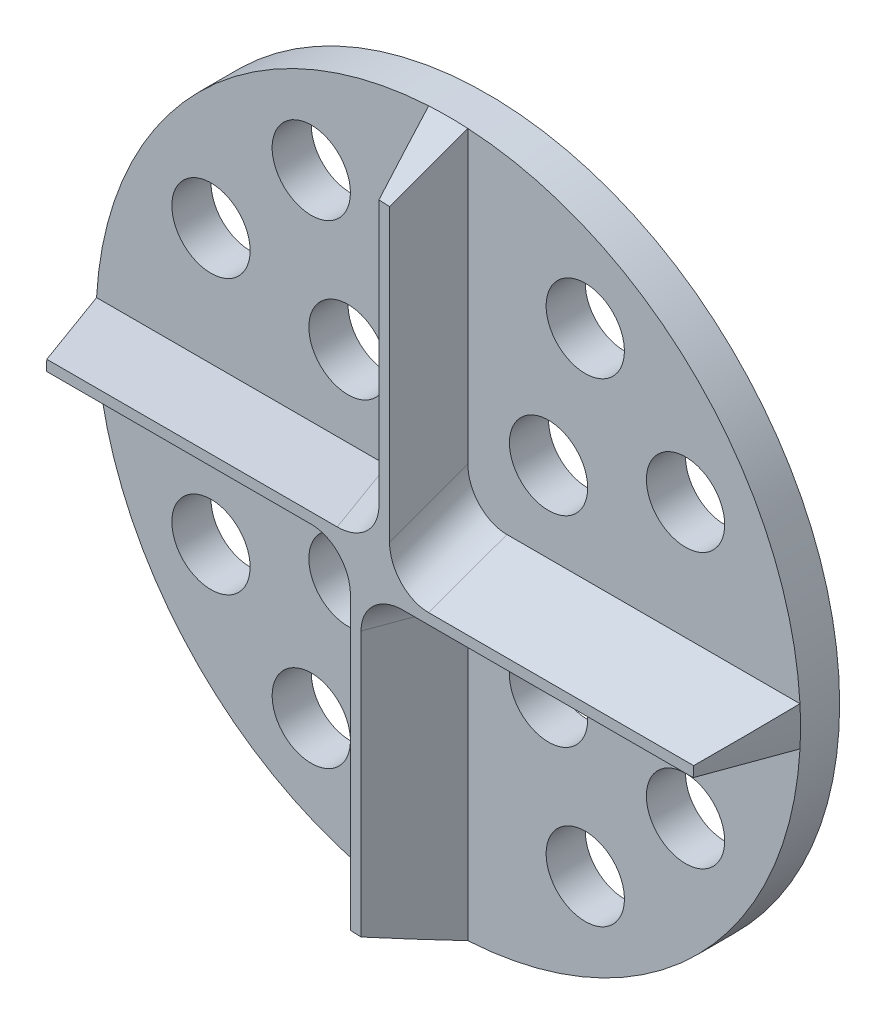
from build123d import *
from build123d.topology import SkipClean

# Parameters (mm, degrees)
BOSS_EXTRUDE1_START = 10
SKETCH1_R           = 45
BOSS_EXTRUDE1_DEPTH = 5
BOSS_EXTRUDE3_DEPTH = 10
CIRPATTERN1_COUNT   = 2
CIRPATTERN1_ANGLE   = 90
SKETCH5_OUTSIDE_W   = 124.038
SKETCH5_OUTSIDE_H   = 124.038
SKETCH5_OUTSIDE_R   = 45
CUT_EXTRUDE1_DEPTH  = 69.82949949
CHAMFER1_START      = -45
CHAMFER1_2_DEPTH    = 42.5
CHAMFER1_START_2    = 2.5
CHAMFER1_3_DEPTH    = 42.5
CHAMFER1_4_DEPTH    = 42.5
CHAMFER1_5_DEPTH    = 42.5
FILLET1_R           = 5
SKETCH6_R           = 5
CUT_EXTRUDE2_DEPTH  = 65.420493634
CIRPATTERN2_COUNT   = 4


with BuildPart() as part:
    # Sketch1 → Boss-Extrude1 (new body)
    with BuildSketch(Plane(origin=(0, 0, 0), x_dir=(0, 1, 0), z_dir=(0, 0, 1)).offset(BOSS_EXTRUDE1_START)):
        with Locations(Location((0, 0, 0), (0, 0, 270))):
            Circle(SKETCH1_R)
    extrude(amount=BOSS_EXTRUDE1_DEPTH)

    # Sketch4 → Boss-Extrude3 (add)
    with BuildSketch(Plane.XY.offset(15)):
        with BuildLine():
            Line((-2.5, -45), (-2.5, 45))
            ThreePointArc((-2.5, 45), (0, 47.5), (2.5, 45))
            Line((2.5, 45), (2.5, -45))
            ThreePointArc((2.5, -45), (0, -47.5), (-2.5, -45))
        make_face()
    boss_extrude3 = extrude(amount=BOSS_EXTRUDE3_DEPTH)

    # CirPattern1: Boss-Extrude3 ×2 about axis
    cirpattern1_axis = Axis((0, 0, 0), (0, 0, 1))
    for i in range(1, CIRPATTERN1_COUNT):
        add(boss_extrude3.rotate(cirpattern1_axis, i * CIRPATTERN1_ANGLE / (CIRPATTERN1_COUNT - 1)))

    # Sketch5 outside → Cut-Extrude1 (cut, through all)
    with SkipClean():  # the faces are left unmerged after this step: merging them gives an invalid solid
        with BuildSketch(Plane(origin=(0, 0, 10), x_dir=(1, 0, 0), z_dir=(0, 0, -1))):
            Rectangle(SKETCH5_OUTSIDE_W, SKETCH5_OUTSIDE_H)
            with Locations(Location((0, 0, 0), (0, 0, 183.184738537))):
                Circle(SKETCH5_OUTSIDE_R, mode=Mode.SUBTRACT)
        extrude(amount=-CUT_EXTRUDE1_DEPTH, mode=Mode.SUBTRACT)

    # Chamfer1: read off the stored shape, not the designer's step
    # Chamfer1 outline → Chamfer1 (revolve, cut)
    with BuildSketch(Plane.XZ):
        Polygon((45, 25), (41.360297657, 25), (45, 15), align=None)
    revolve(axis=Axis((0, 0, 0), (0, 0, 1)), mode=Mode.SUBTRACT)

    # Chamfer1 2 outline → Chamfer1 2 (cut)
    with BuildSketch(Plane(origin=(0, 0, 0), x_dir=(1, 0, 0), z_dir=(0, 1, 0)).offset(CHAMFER1_START)):
        Polygon((2.5, -15), (-1.139702343, -25), (2.5, -25), align=None)
    extrude(amount=CHAMFER1_2_DEPTH, mode=Mode.SUBTRACT)

    # Chamfer1 3 outline → Chamfer1 3 (cut)
    with BuildSketch(Plane(origin=(0, 0, 0), x_dir=(1, 0, 0), z_dir=(0, 1, 0)).offset(CHAMFER1_START_2)):
        Polygon((-2.5, -15), (-2.5, -25), (1.139702343, -25), align=None)
    extrude(amount=CHAMFER1_3_DEPTH, mode=Mode.SUBTRACT)

    # Chamfer1 4 outline → Chamfer1 4 (cut)
    with BuildSketch(Plane.YZ.offset(CHAMFER1_START)):
        Polygon((-2.5, 15), (1.139702343, 25), (-2.5, 25), align=None)
    extrude(amount=CHAMFER1_4_DEPTH, mode=Mode.SUBTRACT)

    # Chamfer1 5 outline → Chamfer1 5 (cut)
    with BuildSketch(Plane.YZ.offset(CHAMFER1_START_2)):
        Polygon((2.5, 15), (2.5, 25), (-1.139702343, 25), align=None)
    extrude(amount=CHAMFER1_5_DEPTH, mode=Mode.SUBTRACT)

    # Fillet1
    fillet1_edges = [part.edges().sort_by_distance(p)[0] for p in [
        (-0.680148828, 2.5, 20),
        (2.5, 0.680148828, 20),
        (0.680148829, -2.5, 20),
        (-2.5, -0.680148829, 20),
    ]]
    fillet(fillet1_edges, radius=FILLET1_R)

    # Sketch6 → Cut-Extrude2 (cut, through all)
    with BuildSketch(Plane.XY.offset(15)):
        with Locations((-30.310889132, 17.5)):
            Circle(SKETCH6_R)
        with Locations((-17.5, 30.310889132)):
            Circle(SKETCH6_R)
        with Locations((-12.810889132, 12.810889132)):
            Circle(SKETCH6_R)
    cut_extrude2 = extrude(amount=-CUT_EXTRUDE2_DEPTH, mode=Mode.SUBTRACT)

    # CirPattern2: Cut-Extrude2 ×4 about axis
    cirpattern2_axis = Axis((0, 0, 0), (0, 0, 1))
    for i in range(1, CIRPATTERN2_COUNT):
        add(cut_extrude2.rotate(cirpattern2_axis, i * 360 / CIRPATTERN2_COUNT), mode=Mode.SUBTRACT)


solid = part.part
